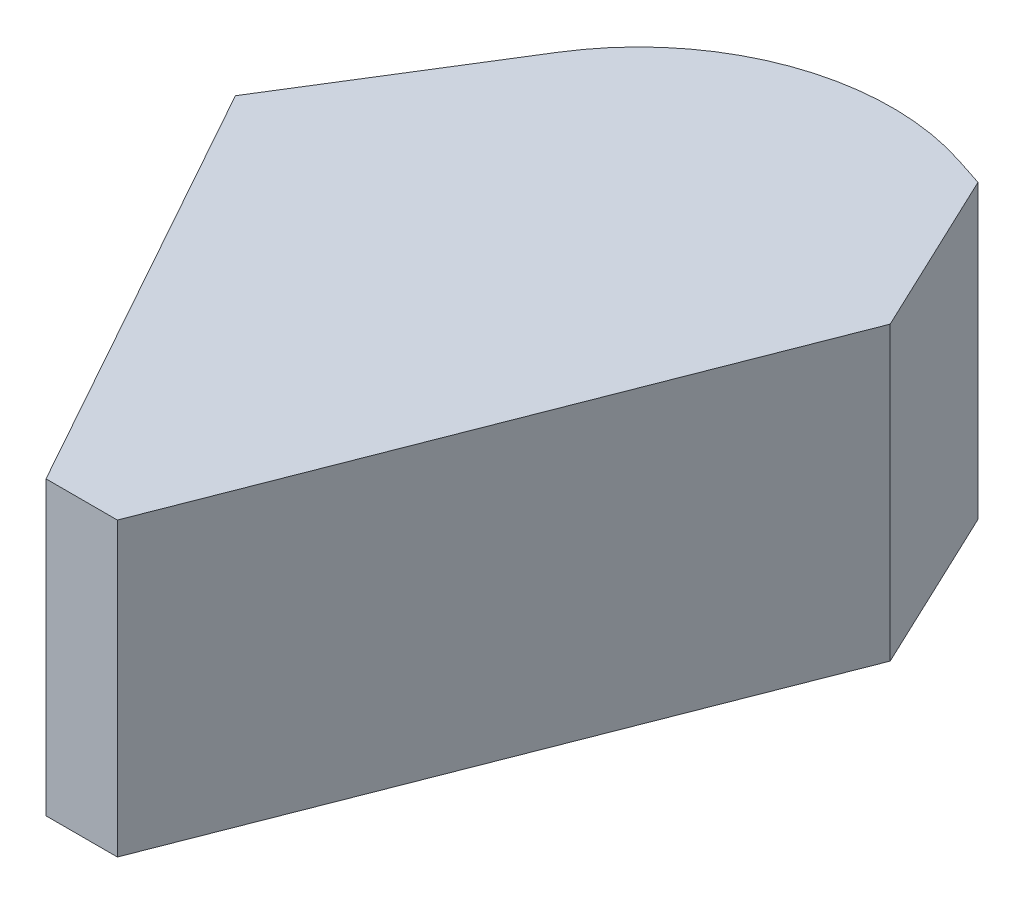
from build123d import *

# Parameters (mm, degrees)
BOSS_EXTRUDE1_DEPTH = 58.42
CHAMFER5_START      = -95.906013746
CHAMFER5_OUTLINE_W  = 100
CHAMFER5_OUTLINE_H  = 58.42
CHAMFER5_DEPTH      = 45.787595784


with BuildPart() as part:
    # Sketch1 → Boss-Extrude1 (new body)
    with BuildSketch(Plane(origin=(0, 0, 0), x_dir=(1, 0, 0), z_dir=(0, 1, 0))):
        with BuildLine():
            Line((-66.673768512, 0), (-37.067821873, 47.633329988))
            ThreePointArc((-37.067821873, 47.633329988), (-11.329209284, 68.541566023), (21.82652777, 69.113940477))
            Line((21.82652777, 69.113940477), (53.138492197, 58.903517294))
            Line((53.138492197, 58.903517294), (0, -77.45185891))
            Line((0, -77.45185891), (-66.673768512, -77.45185891))
            Line((-66.673768512, -77.45185891), (-66.673768512, 0))
        make_face()
    extrude(amount=BOSS_EXTRUDE1_DEPTH)

    # Chamfer4
    # the kernel refuses this chamfer: 25.4 mm, written as the material it takes off along each edge
    with BuildSketch(Plane(origin=(53.138492197, -68.954815123, -58.903517294), x_dir=(-0.9507298394814789, 0, -0.3100205998309166), z_dir=(0, 1, 0))) as chamfer4_piece_1:
        with BuildLine():
            Line((27.572040722, -0.738386759), (0.816641802, 27.56983389))
            Line((0.816641802, 27.56983389), (0.309449153, 27.598462833))
            ThreePointArc((0.309449153, 27.598462833), (0.269734882, 13.792739557), (-0.507192649, 0.028628943))
            Line((-0.507192649, 0.028628943), (0, -0.508))
            ThreePointArc((0, -0.508), (13.786020361, -0.508), (27.572040722, -1.246386759))
            Line((27.572040722, -1.246386759), (27.572040722, -0.738386759))
        make_face()
    extrude(amount=196.329630245, mode=Mode.SUBTRACT)

    # Chamfer5: read off the stored shape, not the designer's step
    # Chamfer5 outline → Chamfer5 (cut)
    with BuildSketch(Plane(origin=(0, 0, 0), x_dir=(0.48585842778436206, 0, 0.8740375210200692), z_dir=(0.8740375210200692, 0, -0.48585842778436206)).offset(CHAMFER5_START)):
        with Locations((12, -29.21)):
            Rectangle(CHAMFER5_OUTLINE_W, CHAMFER5_OUTLINE_H)
    extrude(amount=CHAMFER5_DEPTH, mode=Mode.SUBTRACT)


solid = part.part
